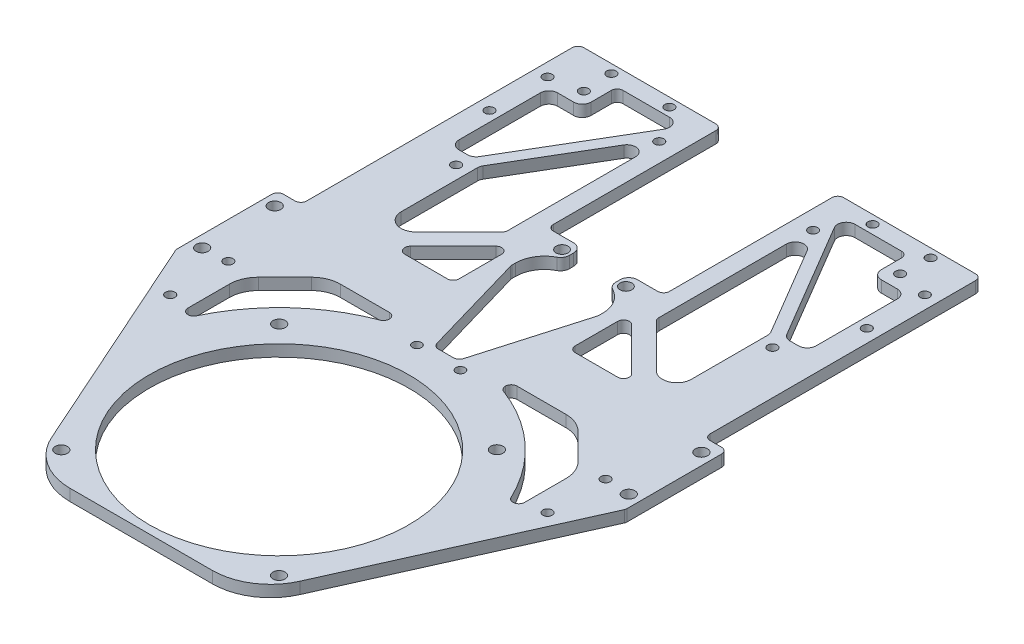
from build123d import *

# Parameters (mm, degrees)
EXTRUDE_1_DEPTH      = 4
SKETCH_2_W           = 16
SKETCH_2_H           = 15
CUT_EXTRUDE_1_DEPTH  = 161.069516148
SKETCH_3_R           = 44.75
CUT_EXTRUDE_2_DEPTH  = 5.25
SKETCH_5_R           = 2.1
CUT_EXTRUDE_3_DEPTH  = 10
FILLET_2_R           = 20
SKETCH_6_W           = 8
SKETCH_6_H           = 50
SKETCH_6_W_2         = 30
SKETCH_6_H_2         = 10
CUT_EXTRUDE_4_DEPTH  = 161.069516148
FILLET_1_R           = 3
CHAMFER_1_SIZE       = 11
CHAMFER_1_SIZE_2     = 38
CHAMFER_2_SIZE       = 38
CHAMFER_2_SIZE_2     = 11
SKETCH_7_R           = 2.1
SKETCH_7_W           = 8
SKETCH_7_H           = 95.5
CUT_EXTRUDE_5_DEPTH  = 161.069516148
SKETCH_10_R          = 2.05
SKETCH_10_R_2        = 1.55
SKETCH_10_R_3        = 1.6
CUT_EXTRUDE_6_DEPTH  = 161.069516148
FILLET_3_R           = 10
FILLET_4_R           = 2
SKETCH_11_W          = 30
SKETCH_11_H          = 97.5
CUT_EXTRUDE_7_DEPTH  = 161.069516148
FILLET_5_R           = 2
FILLET_6_R           = 2
CHAMFER_3_SIZE       = 35
CUT_EXTRUDE_8_DEPTH  = 161.069516148
FILLET_7_R           = 2
FILLET_8_R           = 5
EXTRUDE_2_DEPTH      = 4
FILLET_12_R          = 2
SKETCH_14_W          = 23
SKETCH_14_H          = 34
CUT_EXTRUDE_9_DEPTH  = 161.069516148
EXTRUDE_6_DEPTH      = 4
CHAMFER_4_SIZE       = 15
FILLET_13_R          = 10
FILLET_14_R          = 3
SKETCH_16_R          = 1.6
CUT_EXTRUDE_10_DEPTH = 161.069516287
SKETCH_17_R          = 1.6
CUT_EXTRUDE_11_DEPTH = 10


with BuildPart() as part:
    # 草图1 → 凸台-拉伸1 (new body)
    with BuildSketch(Plane(origin=(0, 0, 0), x_dir=(1, 0, 0), z_dir=(0, 1, 0))):
        Polygon((-77.5, 140), (-77.5, -80), (77.5, -80), (77.5, 140), (22.5, 140), (22.5, 80), (-22.5, 80), (-22.5, 140), align=None)
    extrude(amount=EXTRUDE_1_DEPTH)

    # 草图2 → 切除-拉伸1 (cut, through all)
    with BuildSketch(Plane(origin=(0, 4, 0), x_dir=(1, 0, 0), z_dir=(0, 1, 0))):
        with Locations((0, 80)):
            Rectangle(SKETCH_2_W, SKETCH_2_H)
    extrude(amount=-CUT_EXTRUDE_1_DEPTH, mode=Mode.SUBTRACT)

    # 草图3 → 切除-拉伸2 (cut)
    with BuildSketch(Plane(origin=(0, 4, 0), x_dir=(1, 0, 0), z_dir=(0, 1, 0))):
        with Locations(Location((0, -32.5, 0), (0, 0, 270))):
            Circle(SKETCH_3_R)
    extrude(amount=-CUT_EXTRUDE_2_DEPTH, mode=Mode.SUBTRACT)

    # 草图5 → 切除-拉伸3 (cut)
    with BuildSketch(Plane.XZ):
        with Locations(Location((-37.5, -5.04, 0), (0, 0, 270))):
            Circle(SKETCH_5_R)
        with Locations(Location((-37.5, 70.04, 0), (0, 0, 270))):
            Circle(SKETCH_5_R)
        with Locations(Location((37.5, 70.04, 0), (0, 0, 270))):
            Circle(SKETCH_5_R)
        with Locations(Location((37.5, -5.04, 0), (0, 0, 270))):
            Circle(SKETCH_5_R)
        Polygon((37.5, 80), (77.5, -9.5), (77.5, 80), align=None)
        Polygon((-77.5, 80), (-77.5, -9.5), (-37.5, 80), align=None)
    extrude(amount=-CUT_EXTRUDE_3_DEPTH, mode=Mode.SUBTRACT)

    # 圆角2
    fillet_2_edges = [part.edges().sort_by_distance(p)[0] for p in [
        (37.5, 2, 80),
        (-37.5, 2, 80),
    ]]
    fillet(fillet_2_edges, radius=FILLET_2_R)

    # 草图6 → 切除-拉伸4 (cut, through all)
    with BuildSketch(Plane(origin=(0, 4, 0), x_dir=(1, 0, 0), z_dir=(0, 1, 0))):
        with Locations((0, 50)):
            Rectangle(SKETCH_6_W, SKETCH_6_H)
        with Locations((0, 67.5)):
            Rectangle(SKETCH_6_W_2, SKETCH_6_H_2)
    extrude(amount=-CUT_EXTRUDE_4_DEPTH, mode=Mode.SUBTRACT)

    # 圆角1
    fillet_1_edges = [part.edges().sort_by_distance(p)[0] for p in [
        (8, 2, -80),
        (-8, 2, -80),
        (8, 2, -72.5),
        (-8, 2, -72.5),
    ]]
    fillet(fillet_1_edges, radius=FILLET_1_R)

    # 倒角1
    # the kernel refuses this chamfer: 38, 11 mm, written as the material it takes off along each edge
    with BuildSketch(Plane(origin=(-4, 102.655802662, -62.5), x_dir=(-0.9919296170155132, 0, -0.12678972705806055), z_dir=(0, -1, 0))) as chamfer_1_piece_1_section:
        Polygon((CHAMFER_1_SIZE * 0.991929617016, -CHAMFER_1_SIZE * 0.126789727058), (-CHAMFER_1_SIZE_2 * 0.126789727058, -CHAMFER_1_SIZE_2 * 0.991929617016), (0, 0), align=None)
    chamfer_1_piece_1 = extrude(amount=201.311605324, mode=Mode.PRIVATE)
    chamfer_1_piece_1 = split(chamfer_1_piece_1, bisect_by=Plane(origin=(-15, 2, -49.498313297), z_dir=(1, 0, 0)), keep=Keep.TOP, mode=Mode.PRIVATE)
    chamfer_1_piece_1 = split(chamfer_1_piece_1, bisect_by=Plane(origin=(-7.293881578, 2, -25), z_dir=(0, 0, -1)), keep=Keep.TOP, mode=Mode.PRIVATE)
    add(chamfer_1_piece_1, mode=Mode.SUBTRACT)

    # 倒角2
    # the kernel refuses this chamfer: 38, 11 mm, written as the material it takes off along each edge
    with BuildSketch(Plane(origin=(4, -98.655802662, -62.5), x_dir=(-0.010710172765759795, 0, 0.9999426444548346), z_dir=(0, 1, 0))) as chamfer_2_piece_1_section:
        Polygon((CHAMFER_2_SIZE * 0.999942644455, CHAMFER_2_SIZE * 0.0107101727658), (-CHAMFER_2_SIZE_2 * 0.0107101727658, CHAMFER_2_SIZE_2 * 0.999942644455), (0, 0), align=None)
    chamfer_2_piece_1 = extrude(amount=201.311605324, mode=Mode.PRIVATE)
    chamfer_2_piece_1 = split(chamfer_2_piece_1, bisect_by=Plane(origin=(7.293881578, 2, -25), z_dir=(0, 0, -1)), keep=Keep.TOP, mode=Mode.PRIVATE)
    chamfer_2_piece_1 = split(chamfer_2_piece_1, bisect_by=Plane(origin=(15, 2, -49.498313297), z_dir=(-1, 0, 0)), keep=Keep.TOP, mode=Mode.PRIVATE)
    add(chamfer_2_piece_1, mode=Mode.SUBTRACT)

    # 草图7 → 切除-拉伸5 (cut, through all)
    with BuildSketch(Plane(origin=(0, 4, 0), x_dir=(1, 0, 0), z_dir=(0, 1, 0))):
        with Locations(Location((-73.5, 39.5, 0), (0, 0, 270))):
            Circle(SKETCH_7_R)
        with Locations(Location((-73.5, 14.5, 0), (0, 0, 270))):
            Circle(SKETCH_7_R)
        with Locations(Location((73.5, 14.5, 0), (0, 0, 90))):
            Circle(SKETCH_7_R)
        with Locations(Location((73.5, 39.5, 0), (0, 0, 90))):
            Circle(SKETCH_7_R)
        with Locations((-73.5, 92.25)):
            Rectangle(SKETCH_7_W, SKETCH_7_H)
        with Locations((73.5, 92.25)):
            Rectangle(SKETCH_7_W, SKETCH_7_H)
    extrude(amount=-CUT_EXTRUDE_5_DEPTH, mode=Mode.SUBTRACT)

    # 草图10 → 切除-拉伸6 (cut, through all)
    with BuildSketch(Plane(origin=(0, 4, 0), x_dir=(1, 0, 0), z_dir=(0, 1, 0))):
        with Locations(Location((-11, 76, 0), (0, 0, 90))):
            Circle(SKETCH_10_R)
        with Locations(Location((-7.5, 22.5, 0), (0, 0, 90))):
            Circle(SKETCH_10_R_2)
        with Locations(Location((-54.5, 127, 0), (0, 0, 90))):
            Circle(SKETCH_10_R_3)
        with Locations(Location((-54.5, 83, 0), (0, 0, 90))):
            Circle(SKETCH_10_R_3)
        with Locations(Location((65, 125, 0), (0, 0, 270))):
            Circle(SKETCH_10_R_3)
        with Locations(Location((65, 105, 0), (0, 0, 270))):
            Circle(SKETCH_10_R_3)
        with Locations(Location((65, 15, 0), (0, 0, 270))):
            Circle(SKETCH_10_R_3)
        with Locations(Location((65, -5, 0), (0, 0, 270))):
            Circle(SKETCH_10_R_3)
        with Locations(Location((-65, -5, 0), (0, 0, 90))):
            Circle(SKETCH_10_R_3)
        with Locations(Location((-65, 15, 0), (0, 0, 90))):
            Circle(SKETCH_10_R_3)
        with Locations(Location((-65, 105, 0), (0, 0, 90))):
            Circle(SKETCH_10_R_3)
        with Locations(Location((-65, 125, 0), (0, 0, 90))):
            Circle(SKETCH_10_R_3)
        with Locations(Location((54.5, 83, 0), (0, 0, 270))):
            Circle(SKETCH_10_R_3)
        with Locations(Location((54.5, 127, 0), (0, 0, 270))):
            Circle(SKETCH_10_R_3)
        with Locations(Location((7.5, 22.5, 0), (0, 0, 270))):
            Circle(SKETCH_10_R_2)
        with Locations(Location((11, 76, 0), (0, 0, 270))):
            Circle(SKETCH_10_R)
    extrude(amount=-CUT_EXTRUDE_6_DEPTH, mode=Mode.SUBTRACT)

    # 圆角3
    # the kernel refuses this fillet: 10 mm, written as the material it adds along each edge
    with BuildSketch(Plane(origin=(-15, 4, -72.5), x_dir=(0.9980282599820154, 0, -0.06276617144028053), z_dir=(0, -1, 0))) as fillet_3_piece_1:
        with BuildLine():
            CenterArc((9.444726313, 9.143400314), FILLET_3_R, 183.5986022, 62.51357375)
            Line((-0.535556287, 8.5157386), (-1.533584547, 8.452972428))
            Line((-1.533584547, 8.452972428), (-0.99802826, -0.062766171))
            Line((-0.99802826, -0.062766171), (0.062766171, -0.99802826))
            ThreePointArc((0.062766171, -0.99802826), (4.054879211, -0.746963574), (4.990306133, -0.914340031))
            Line((4.990306133, -0.914340031), (5.395253422, 0))
        make_face()
    extrude(amount=4)
    with BuildSketch(Plane(origin=(15, 4, -72.5), x_dir=(0, 0, 1), z_dir=(0, -1, 0))) as fillet_3_piece_2:
        with BuildLine():
            CenterArc((8.532562595, 10), FILLET_3_R, 207.48642625, 62.51357375)
            Line((-0.338639401, 5.384615385), (-1.225759601, 4.923076923))
            ThreePointArc((-1.225759601, 4.923076923), (-1, 4), (-1, 0))
            Line((-1, 0), (0, -1))
            Line((0, -1), (8.532562595, -1))
            Line((8.532562595, -1), (8.532562595, 0))
        make_face()
    extrude(amount=4)

    # 圆角4
    fillet_4_edges = [part.edges().sort_by_distance(p)[0] for p in [
        (-4.144736842, 2, -25),
        (4.144736842, 2, -25),
        (77.5, 2, -44.5),
        (69.5, 2, -44.5),
        (-77.5, 2, -44.5),
        (-69.5, 2, -44.5),
    ]]
    fillet(fillet_4_edges, radius=FILLET_4_R)

    # 草图11 → 切除-拉伸7 (cut, through all)
    with BuildSketch(Plane(origin=(0, 4, 0), x_dir=(1, 0, 0), z_dir=(0, 1, 0))):
        with Locations((-35, 91.25)):
            Rectangle(SKETCH_11_W, SKETCH_11_H)
        with Locations((35, 91.25)):
            Rectangle(SKETCH_11_W, SKETCH_11_H)
        with BuildLine():
            ThreePointArc((20, 24.068542495), (36.904157598, 14.808383527), (50, 0.666247904))
            Line((50, 0.666247904), (50, 27.5))
            Line((50, 27.5), (20, 27.5))
            Line((20, 27.5), (20, 24.068542495))
        make_face()
        with BuildLine():
            Line((50, 27.5), (50, 0.666247904))
            ThreePointArc((50, 0.666247904), (54.728833497, -7.908237476), (58, -17.137708504))
            Line((58, -17.137708504), (58, 27.5))
            Line((58, 27.5), (50, 27.5))
        make_face()
        with BuildLine():
            ThreePointArc((-50, 0.666247904), (-36.904157598, 14.808383527), (-20, 24.068542495))
            Line((-20, 24.068542495), (-20, 27.5))
            Line((-20, 27.5), (-50, 27.5))
            Line((-50, 27.5), (-50, 0.666247904))
        make_face()
        with BuildLine():
            ThreePointArc((-58, -17.137708504), (-54.728833497, -7.908237476), (-50, 0.666247904))
            Line((-50, 0.666247904), (-50, 27.5))
            Line((-50, 27.5), (-58, 27.5))
            Line((-58, 27.5), (-58, -17.137708504))
        make_face()
    extrude(amount=-CUT_EXTRUDE_7_DEPTH, mode=Mode.SUBTRACT)

    # 圆角5
    fillet_5_edges = [part.edges().sort_by_distance(p)[0] for p in [
        (-20, 2, -24.068542495),
        (-58, 2, 17.137708504),
        (-20, 2, -27.5),
    ]]
    fillet(fillet_5_edges, radius=FILLET_5_R)

    # 圆角6
    fillet_6_edges = [part.edges().sort_by_distance(p)[0] for p in [
        (58, 2, 17.137708504),
        (20, 2, -24.068542495),
        (20, 2, -27.5),
    ]]
    fillet(fillet_6_edges, radius=FILLET_6_R)

    # 倒角3
    # the kernel refuses this chamfer: 35 mm, written as the material it adds along each edge
    with BuildSketch(Plane(origin=(-20, 4, -42.5), x_dir=(-0.9996219169112968, 0, 0.027495876610586518), z_dir=(0, -1, 0)), Plane(origin=(20, 4, -42.5), x_dir=(-0.02749587661058651, 0, -0.9996219169112968), z_dir=(0, -1, 0))) as chamfer_3_piece_1:
        Polygon((CHAMFER_3_SIZE * 0.999621916911, CHAMFER_3_SIZE * 0.0274958766106), (-CHAMFER_3_SIZE * 0.0274958766106, CHAMFER_3_SIZE * 0.999621916911), (0, 0), align=None)
    extrude(amount=4)

    # 草图12 → 切除-拉伸8 (cut, through all)
    with BuildSketch(Plane(origin=(0, 4, 0), x_dir=(1, 0, 0), z_dir=(0, 1, 0))):
        Polygon((-20, 47.5), (-20, 69.014718626), (-41.514718626, 47.5), align=None)
        Polygon((20, 47.5), (41.514718626, 47.5), (20, 69.014718626), align=None)
    extrude(amount=-CUT_EXTRUDE_8_DEPTH, mode=Mode.SUBTRACT)

    # 圆角7
    fillet_7_edges = [part.edges().sort_by_distance(p)[0] for p in [
        (-20, 2, -69.014718626),
        (-20, 2, -47.5),
        (-41.514718626, 2, -47.5),
        (41.514718626, 2, -47.5),
        (20, 2, -47.5),
        (20, 2, -69.014718626),
    ]]
    fillet(fillet_7_edges, radius=FILLET_7_R)

    # 圆角8
    fillet_8_edges = [part.edges().sort_by_distance(p)[0] for p in [
        (-50, 2, -47.5),
        (50, 2, -47.5),
    ]]
    fillet(fillet_8_edges, radius=FILLET_8_R)

    # 草图13 → 凸台-拉伸2 (add)
    with BuildSketch(Plane(origin=(0, 4, 0), x_dir=(1, 0, 0), z_dir=(0, 1, 0))):
        Polygon((-50, 140), (-20, 140), (-20, 77.5), (-26, 71.5), (-26, 134), (-50, 134), align=None)
        Polygon((26, 134), (26, 71.5), (20, 77.5), (20, 140), (50, 140), (50, 134), align=None)
    extrude(amount=-EXTRUDE_2_DEPTH)

    # 圆角12
    fillet_12_edges = [part.edges().sort_by_distance(p)[0] for p in [
        (-15, 2, -62.5),
        (15, 2, -62.5),
        (69.5, 2, -140),
        (-69.5, 2, -140),
        (-20, 2, -80),
        (20, 2, -80),
        (-50, 2, -134),
        (-20, 2, -140),
        (-26, 2, -71.5),
        (-26, 2, -134),
        (26, 2, -71.5),
        (20, 2, -140),
        (50, 2, -134),
        (26, 2, -134),
        (77.5, 2, -9.5),
        (-77.5, 2, -9.5),
    ]]
    fillet(fillet_12_edges, radius=FILLET_12_R)

    # 草图14 → 切除-拉伸9 (cut, through all)
    with BuildSketch(Plane.XZ):
        with Locations((50, -105)):
            Rectangle(SKETCH_14_W, SKETCH_14_H)
        with Locations((-50, -105)):
            Rectangle(SKETCH_14_W, SKETCH_14_H)
    extrude(amount=-CUT_EXTRUDE_9_DEPTH, mode=Mode.SUBTRACT)

    # 草图15 → 凸台-拉伸6 (add)
    with BuildSketch(Plane.XZ):
        with BuildLine():
            Line((53.868533153, -88), (23.721853056, -139.017458624))
            ThreePointArc((23.721853056, -139.017458624), (20.982541376, -139.721853056), (20.278146944, -136.982541376))
            Line((20.278146944, -136.982541376), (50, -86.684020819))
            Line((50, -86.684020819), (50, -88))
            Line((50, -88), (53.868533153, -88))
        make_face()
    extrude_6 = extrude(amount=-EXTRUDE_6_DEPTH)

    # 倒角4
    chamfer_4_edges = [part.edges().sort_by_distance(p)[0] for p in [
        (-58, 2, -27.5),
        (58, 2, -27.5),
    ]]
    chamfer(chamfer_4_edges, length=CHAMFER_4_SIZE)

    # 圆角13
    fillet_13_edges = [part.edges().sort_by_distance(p)[0] for p in [
        (43, 2, -27.5),
        (58, 2, -12.5),
        (-58, 2, -12.5),
        (-43, 2, -27.5),
    ]]
    fillet(fillet_13_edges, radius=FILLET_13_R)

    # 镜向1: 凸台-拉伸6 across plane
    add(extrude_6.mirror(Plane(origin=(0, 0, 0), x_dir=(0, 0, 1), z_dir=(1, 0, 0))))

    # 圆角14
    fillet_14_edges = [part.edges().sort_by_distance(p)[0] for p in [
        (53.868533153, 2, -88),
        (61.5, 2, -88),
        (61.5, 2, -122),
        (50, 2, -122),
        (26.886729444, 2, -133.661513969),
        (50, 2, -86.684020819),
        (26, 2, -127.299405434),
        (-50, 2, -122),
        (-61.5, 2, -122),
        (-61.5, 2, -88),
        (-53.868533153, 2, -88),
        (-50, 2, -86.684020819),
        (-26, 2, -127.299405434),
        (-26.886729444, 2, -133.661513969),
    ]]
    fillet(fillet_14_edges, radius=FILLET_14_R)

    # 草图16 → 切除-拉伸10 (cut, through all)
    with BuildSketch(Plane(origin=(0, 4, 0), x_dir=(1, 0, 0), z_dir=(0, 1, 0))):
        with Locations(Location((-26.5, 125, 0), (0, 0, 270))):
            Circle(SKETCH_16_R)
        with Locations(Location((26.5, 125, 0), (0, 0, 90))):
            Circle(SKETCH_16_R)
    extrude(amount=-CUT_EXTRUDE_10_DEPTH, mode=Mode.SUBTRACT)

    # 草图17 → 切除-拉伸11 (cut)
    with BuildSketch(Plane(origin=(0, 4, 0), x_dir=(1, 0, 0), z_dir=(0, 1, 0))):
        with Locations(Location((-35, 137, 0), (0, 0, 270))):
            Circle(SKETCH_17_R)
        with Locations(Location((-55, 137, 0), (0, 0, 270))):
            Circle(SKETCH_17_R)
        with Locations(Location((55, 137, 0), (0, 0, 270))):
            Circle(SKETCH_17_R)
        with Locations(Location((35, 137, 0), (0, 0, 270))):
            Circle(SKETCH_17_R)
    extrude(amount=-CUT_EXTRUDE_11_DEPTH, mode=Mode.SUBTRACT)


solid = part.part
